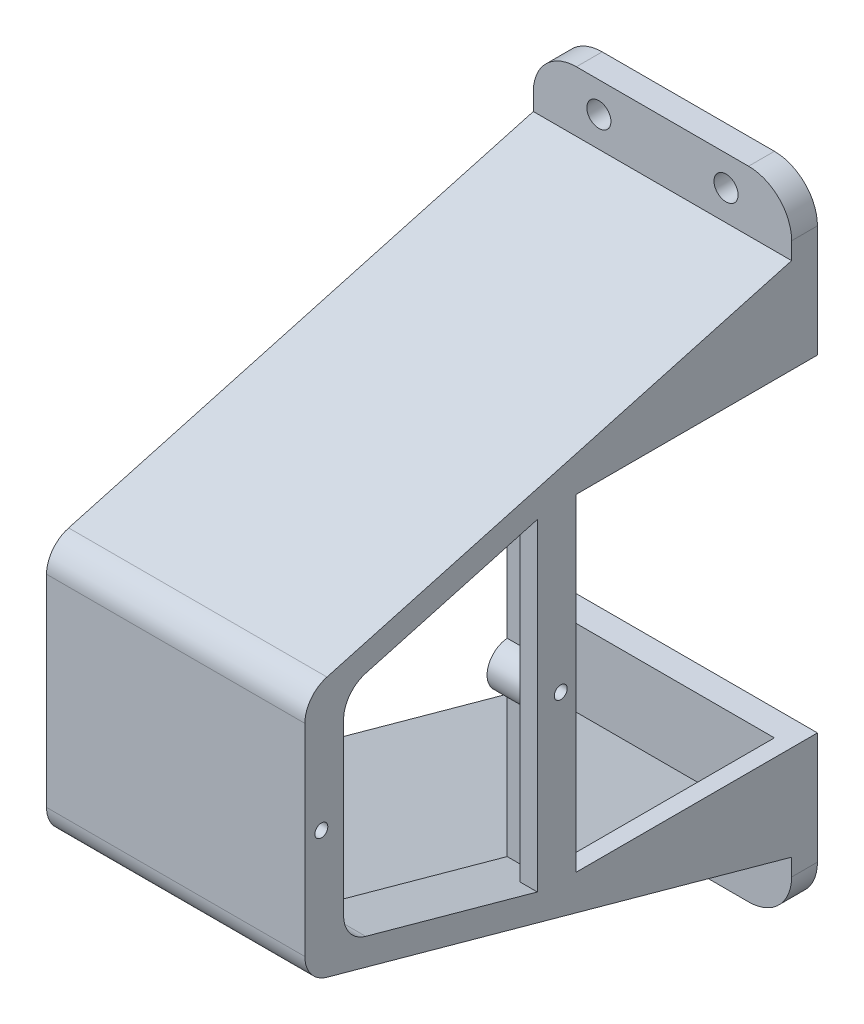
from build123d import *

# Parameters (mm, degrees)
BOSS_EXTRU_1_DEPTH      = 30
CONG_5_R                = 3.5
ESQUISSE3_R             = 1.5
ENL_V_MAT_EXTRU_1_DEPTH = 108.552111318
COQUE5_START            = -74.72972973
COQUE5_DEPTH            = 26
BOSS_EXTRU_5_DEPTH      = 4
BOSS_EXTRU_6_START      = 4
BOSS_EXTRU_6_DEPTH      = 4
ENL_V_START             = -2
ENL_V_MAT_EXTRU_5_DEPTH = 2
ESQUISSE11_W            = 30
ESQUISSE11_H            = 3
BOSS_EXTRU_8_DEPTH      = 18
NERVURE1_REACH          = 85.236
ESQUISSE12_WALL_W       = 25.034902344
ESQUISSE12_WALL_H       = 2
ESQUISSE13_R            = 0.75
ENL_V_MAT_EXTRU_6_DEPTH = 8
BOSS_EXTRU_9_DEPTH      = 6
BOSS_EXTRU_10_DEPTH     = 2.5
CONG_7_R                = 2
ENL_V_MAT_EXTRU_7_DEPTH = 4
CONG_9_R                = 5
ESQUISSE22_R            = 1.4
ENL_V_MAT_EXTRU_8_DEPTH = 108.552111389


# Read off the part's stored shape, not the designer's step: Coque5
with BuildPart() as part:
    # Esquisse2 → Boss.-Extru.1 (new body)
    with BuildSketch(Plane(origin=(-46.72972973, 0, -4), x_dir=(0, 1, 0), z_dir=(1, 0, 0))):
        Polygon((-49.837837838, 4), (-40.553869421, 4), (-32.813706623, 32.034902345), (7.138030947, 32.034902345), (14.878193746, 4), (24.162162162, 4), (24.162162162, 7), (17.162162162, 7), (1.553427739, 63.534902), (-27.229103415, 63.534902), (-42.837837838, 7), (-49.837837838, 7), align=None)
        Polygon((-31.571300562, 36.534902345), (5.895624886, 36.534902345), (-0.316405324, 59.034902), (-25.359270352, 59.034902), align=None, mode=Mode.SUBTRACT)
    extrude(amount=-BOSS_EXTRU_1_DEPTH)

    # Congé5
    cong_5_edges = [part.edges().sort_by_distance(p)[0] for p in [
        (-61.72972973, -27.229103415, 59.534902),
        (-61.72972973, 1.553427739, 59.534902),
        (-61.72972973, -25.359270352, 55.034902),
        (-61.72972973, -0.316405324, 55.034902),
    ]]
    fillet(cong_5_edges, radius=CONG_5_R)

    # Esquisse3 → Enlèv. mat.-Extru.1 (cut, through all)
    with BuildSketch(Plane.XY.offset(3)):
        with Locations((-69.22972973, 20.662162162)):
            Circle(ESQUISSE3_R)
        with Locations(Location((-54.22972973, 20.662162162, 0), (0, 0, 180))):
            Circle(ESQUISSE3_R)
        with Locations((-54.22972973, -46.337837838)):
            Circle(ESQUISSE3_R)
        with Locations(Location((-69.22972973, -46.337837838, 0), (0, 0, 180))):
            Circle(ESQUISSE3_R)
    extrude(amount=-ENL_V_MAT_EXTRU_1_DEPTH, mode=Mode.SUBTRACT)

    # Coque5 outline → Coque5 (cut)
    with BuildSketch(Plane.YZ.offset(COQUE5_START)):
        with BuildLine():
            Line((-26.010377917, 56.434102065), (-41.039101991, 2))
            Line((-41.039101991, 2), (-40.00168895, 2))
            Line((-40.00168895, 2), (-32.813706623, 28.034902345))
            Line((-32.813706623, 28.034902345), (7.138030947, 28.034902345))
            Line((7.138030947, 28.034902345), (14.326013274, 2))
            Line((14.326013274, 2), (15.363426315, 2))
            Line((15.363426315, 2), (0.334702242, 56.434102065))
            ThreePointArc((0.334702242, 56.434102065), (-0.202576772, 57.22838432), (-1.11120208, 57.534902))
            Line((-1.11120208, 57.534902), (-24.564473595, 57.534902))
            ThreePointArc((-24.564473595, 57.534902), (-25.473098904, 57.22838432), (-26.010377917, 56.434102065))
        make_face()
        with BuildLine():
            Line((-31.571300562, 32.534902345), (-26.068417283, 52.466368819))
            ThreePointArc((-26.068417283, 52.466368819), (-24.814766252, 54.319694081), (-22.694640532, 55.034902))
            Line((-22.694640532, 55.034902), (-2.981035143, 55.034902))
            ThreePointArc((-2.981035143, 55.034902), (-0.860909424, 54.319694081), (0.392741608, 52.466368819))
            Line((0.392741608, 52.466368819), (5.895624886, 32.534902345))
            Line((5.895624886, 32.534902345), (-31.571300562, 32.534902345))
        make_face(mode=Mode.SUBTRACT)
    extrude(amount=COQUE5_DEPTH, mode=Mode.SUBTRACT)

    # Esquisse6 → Boss.-Extru.5 (add)
    with BuildSketch(Plane.ZY.offset(48.72972973)):
        Polygon((32.534902345, -32.608713603), (28.034902345, -33.851119664), (28.034902345, 8.175443988), (32.534902345, 6.933037927), align=None)
    extrude(amount=BOSS_EXTRU_5_DEPTH)

    # Esquisse7 → Boss.-Extru.6 (add)
    with BuildSketch(Plane.ZY.offset(48.72972973).offset(BOSS_EXTRU_6_START)):
        with BuildLine():
            Line((57.534902, -24.564473595), (57.534902, -1.11120208))
            ThreePointArc((57.534902, -1.11120208), (57.22838432, -0.202576772), (56.434102065, 0.334702242))
            Line((56.434102065, 0.334702242), (32.534902345, 6.933037927))
            Line((32.534902345, 6.933037927), (32.534902345, 5.895624886))
            Line((32.534902345, 5.895624886), (52.466368819, 0.392741608))
            ThreePointArc((52.466368819, 0.392741608), (54.319694081, -0.860909424), (55.034902, -2.981035143))
            Line((55.034902, -2.981035143), (55.034902, -22.694640532))
            ThreePointArc((55.034902, -22.694640532), (54.319694081, -24.814766252), (52.466368819, -26.068417283))
            Line((52.466368819, -26.068417283), (32.534902345, -31.571300562))
            Line((32.534902345, -31.571300562), (32.534902345, -32.608713603))
            Line((32.534902345, -32.608713603), (56.434102065, -26.010377917))
            ThreePointArc((56.434102065, -26.010377917), (57.22838432, -25.473098904), (57.534902, -24.564473595))
        make_face()
    extrude(amount=-BOSS_EXTRU_6_DEPTH)

    # Esquisse9 → Enlèv. mat.-Extru.5 (cut)
    with BuildSketch(Plane(origin=(-74.72972973, 0, 0), x_dir=(0, 0, -1), z_dir=(1, 0, 0)).offset(ENL_V_START)):
        with BuildLine():
            Line((-2, 15.363426315), (-56.434102065, 0.334702242))
            ThreePointArc((-56.434102065, 0.334702242), (-57.22838432, -0.202576772), (-57.534902, -1.11120208))
            Line((-57.534902, -1.11120208), (-57.534902, -24.564473595))
            ThreePointArc((-57.534902, -24.564473595), (-57.22838432, -25.473098904), (-56.434102065, -26.010377917))
            Line((-56.434102065, -26.010377917), (-2, -41.039101991))
            Line((-2, -41.039101991), (-2, -40.00168895))
            Line((-2, -40.00168895), (-28.034902345, -32.813706623))
            Line((-28.034902345, -32.813706623), (-28.034902345, 7.138030947))
            Line((-28.034902345, 7.138030947), (-2, 14.326013274))
            Line((-2, 14.326013274), (-2, 15.363426315))
        make_face()
    extrude(amount=ENL_V_MAT_EXTRU_5_DEPTH, mode=Mode.SUBTRACT)

    # Esquisse11 → Boss.-Extru.8 (add)
    with BuildSketch(Plane.XZ.offset(49.837837838)):
        with Locations((-61.72972973, 1.5)):
            Rectangle(ESQUISSE11_W, ESQUISSE11_H)
    boss_extru_8 = extrude(amount=-BOSS_EXTRU_8_DEPTH)

    # Esquisse12 wall → Nervure1 (add, up to next)
    with BuildSketch(Plane(origin=(-46.72972973, -31.837837838, 15.517451172), x_dir=(0, 0, -1), z_dir=(0, 1, 0)), mode=Mode.PRIVATE) as nervure1_sk1:
        with Locations((0, 1)):
            Rectangle(ESQUISSE12_WALL_W, ESQUISSE12_WALL_H)
    nervure1_tool1 = extrude(nervure1_sk1.sketch, amount=-NERVURE1_REACH, mode=Mode.PRIVATE) - part.part
    nervure1 = nervure1_tool1.solids().sort_by_distance((-46.72972973, -31.837837838, 15.517451172))[0]
    add(nervure1)

    # Symétrie1: Boss.-Extru.8, Nervure1 across plane
    add(boss_extru_8.mirror(Plane.ZX.offset(-12.837837838)))
    add(nervure1.mirror(Plane.ZX.offset(-12.837837838)))

    # Esquisse13 → Enlèv. mat.-Extru.6 (cut)
    with BuildSketch(Plane(origin=(-46.72972973, 0, 0), x_dir=(0, 0, -1), z_dir=(1, 0, 0))):
        with Locations((-57.618809014, -12.837837838)):
            Circle(ESQUISSE13_R)
        with Locations((-29.818809014, -12.837837838)):
            Circle(ESQUISSE13_R)
    extrude(amount=-ENL_V_MAT_EXTRU_6_DEPTH, mode=Mode.SUBTRACT)

    # Esquisse15 → Boss.-Extru.9 (add)
    with BuildSketch(Plane.ZY.offset(52.72972973)):
        with BuildLine():
            Line((57.534902, -15.386456996), (57.534902, -13.583129467))
            ThreePointArc((57.534902, -13.583129467), (56.868809014, -12.837837838), (57.534902, -12.092546208))
            Line((57.534902, -12.092546208), (57.534902, -10.28921868))
            ThreePointArc((57.534902, -10.28921868), (55.068809014, -12.837837838), (57.534902, -15.386456996))
        make_face()
    extrude(amount=BOSS_EXTRU_9_DEPTH)

    # Esquisse16 → Boss.-Extru.10 (add)
    with BuildSketch(Plane.ZY.offset(58.72972973)):
        with BuildLine():
            Line((57.534902, -15.386456996), (57.534902, -10.28921868))
            ThreePointArc((57.534902, -10.28921868), (55.068809014, -12.837837838), (57.534902, -15.386456996))
        make_face()
    extrude(amount=BOSS_EXTRU_10_DEPTH)

    # Congé7
    cong_7_edges = [part.edges().sort_by_distance(p)[0] for p in [
        (-61.22972973, -12.837837838, 55.068809014),
    ]]
    fillet(cong_7_edges, radius=CONG_7_R)

    # Esquisse17 → Enlèv. mat.-Extru.7 (cut)
    with BuildSketch(Plane.ZY.offset(52.72972973)):
        with BuildLine():
            Line((30.034902345, 6.585850475), (32.534902345, 5.895624886))
            Line((32.534902345, 5.895624886), (32.534902345, -31.571300562))
            Line((32.534902345, -31.571300562), (30.034902345, -32.261526151))
            Line((30.034902345, -32.261526151), (30.034902345, -15.378665198))
            ThreePointArc((30.034902345, -15.378665198), (32.368809014, -12.837837838), (30.034902345, -10.297010478))
            Line((30.034902345, -10.297010478), (30.034902345, 6.585850475))
        make_face()
    extrude(amount=-ENL_V_MAT_EXTRU_7_DEPTH, mode=Mode.SUBTRACT)

    # Congé9
    cong_9_edges = [part.edges().sort_by_distance(p)[0] for p in [
        (-76.72972973, -49.837837838, 1.5),
        (-76.72972973, 24.162162162, 1.5),
        (-46.72972973, 24.162162162, 1.5),
        (-46.72972973, -49.837837838, 1.5),
    ]]
    fillet(cong_9_edges, radius=CONG_9_R)

    # Esquisse22 → Enlèv. mat.-Extru.8 (cut, through all)
    with BuildSketch(Plane.XY.offset(3)):
        with Locations((-69.114577733, 20.662162162)):
            Circle(ESQUISSE22_R)
        with Locations(Location((-54.344881726, 20.662162162, 0), (0, 0, 180))):
            Circle(ESQUISSE22_R)
        with Locations((-54.344881726, -46.337837838)):
            Circle(ESQUISSE22_R)
        with Locations(Location((-69.114577733, -46.337837838, 0), (0, 0, 180))):
            Circle(ESQUISSE22_R)
    extrude(amount=-ENL_V_MAT_EXTRU_8_DEPTH, mode=Mode.SUBTRACT)


solid = part.part
